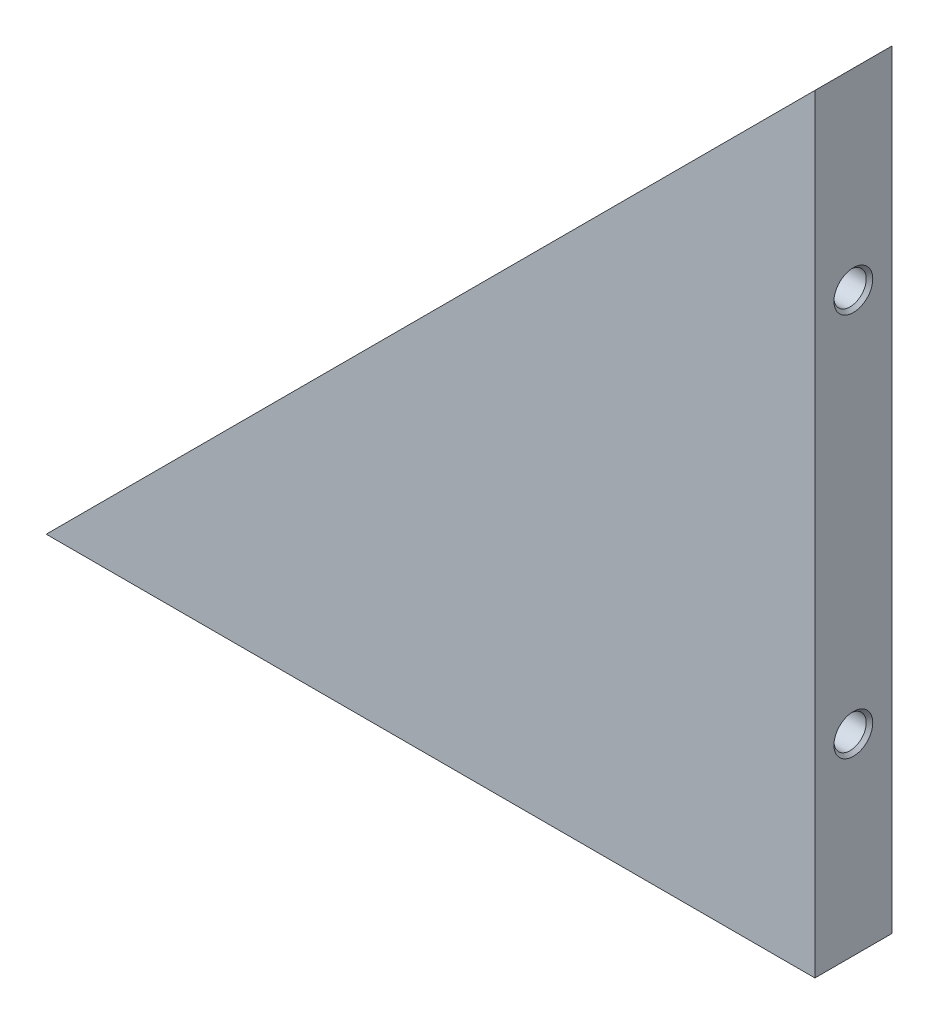
from build123d import *

# Parameters (mm, degrees)
AUFSATZ_LINEAR_AUSTRAGEN1_DEPTH = 10
M5_GEWINDEBOHRUNG2_D            = 4.2
M5_GEWINDEBOHRUNG2_DEPTH        = 20
M5_GEWINDEBOHRUNG2_CSINK_D      = 5.05
M5_GEWINDEBOHRUNG2_CSINK_ANGLE  = 90
M5_GEWINDEBOHRUNG2_TIP          = 1.2618073
M5_GEWINDEBOHRUNG3_D            = 4.2
M5_GEWINDEBOHRUNG3_DEPTH        = 20
M5_GEWINDEBOHRUNG3_CSINK_D      = 5.05
M5_GEWINDEBOHRUNG3_CSINK_ANGLE  = 90
M5_GEWINDEBOHRUNG3_TIP          = 1.2618073


with BuildPart() as part:
    # Skizze1 → Aufsatz-Linear austragen1 (new body)
    with BuildSketch(Plane.XY):
        Polygon((100, 0), (100, 100), (0, 0), align=None)
    extrude(amount=AUFSATZ_LINEAR_AUSTRAGEN1_DEPTH)

    # M5 Gewindebohrung2
    with Locations(Plane(origin=(100, 0, 0), x_dir=(0, 0, -1), z_dir=(1, 0, 0))):
        with Locations((-5, 75), (-5, 25)):
            CounterSinkHole(M5_GEWINDEBOHRUNG2_D / 2, M5_GEWINDEBOHRUNG2_CSINK_D / 2, depth=M5_GEWINDEBOHRUNG2_DEPTH, counter_sink_angle=M5_GEWINDEBOHRUNG2_CSINK_ANGLE)
            with Locations((0, 0, -(M5_GEWINDEBOHRUNG2_DEPTH + M5_GEWINDEBOHRUNG2_TIP / 2))):  # 118° drill point
                Cone(0, M5_GEWINDEBOHRUNG2_D / 2, M5_GEWINDEBOHRUNG2_TIP, mode=Mode.SUBTRACT)

    # M5 Gewindebohrung3
    with Locations(Plane(origin=(0, 0, 0), x_dir=(-1, 0, 0), z_dir=(0, -1, 0))):
        with Locations((-25, -5), (-75, -5)):
            CounterSinkHole(M5_GEWINDEBOHRUNG3_D / 2, M5_GEWINDEBOHRUNG3_CSINK_D / 2, depth=M5_GEWINDEBOHRUNG3_DEPTH, counter_sink_angle=M5_GEWINDEBOHRUNG3_CSINK_ANGLE)
            with Locations((0, 0, -(M5_GEWINDEBOHRUNG3_DEPTH + M5_GEWINDEBOHRUNG3_TIP / 2))):  # 118° drill point
                Cone(0, M5_GEWINDEBOHRUNG3_D / 2, M5_GEWINDEBOHRUNG3_TIP, mode=Mode.SUBTRACT)


solid = part.part
